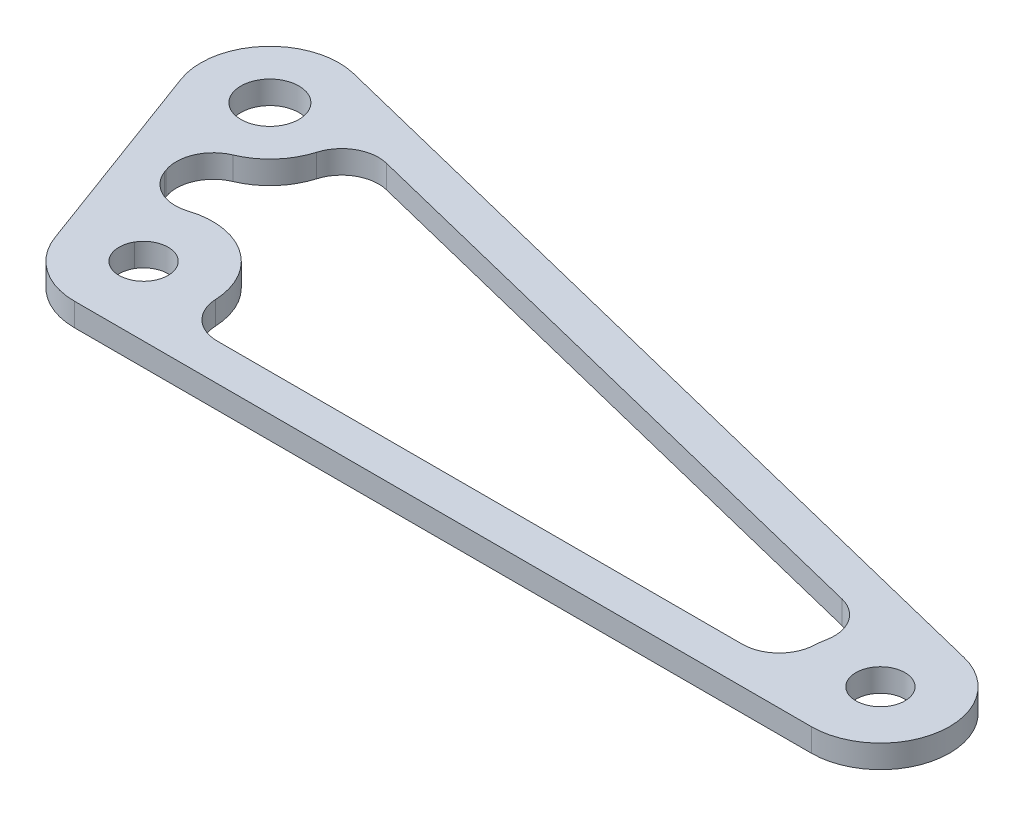
from build123d import *

# Parameters (mm, degrees)
SKETCH1_R           = 4
SKETCH1_R_2         = 3.3782
BOSS_EXTRUDE2_DEPTH = 3.175
CUT_EXTRUDE1_DEPTH  = 118.182825469
FILLET1_R           = 5.08


with BuildPart() as part:
    # Sketch1 → Boss-Extrude2 (new body)
    with BuildSketch(Plane(origin=(0, 0, 0), x_dir=(1, 0, 0), z_dir=(0, 1, 0))):
        with BuildLine():
            Line((103.850244371, 9.24666012), (-7.94064525, 36.881723073))
            ThreePointArc((-7.94064525, 36.881723073), (-17.328317762, 33.98243214), (-19.159429046, 24.329385234))
            Line((-19.159429046, 24.329385234), (-8.932978817, -3.305679122))
            ThreePointArc((-8.932978817, -3.305679122), (-5.442381435, -7.817039678), (0, -9.525))
            Line((0, -9.525), (101.56444, -9.525))
            ThreePointArc((101.56444, -9.525), (111.019598979, -1.151344291), (103.850244371, 9.24666012))
        make_face()
        with Locations((-10.226449718, 27.635062977)):
            Circle(SKETCH1_R, mode=Mode.SUBTRACT)
        with Locations((101.56444, 0)):
            Circle(SKETCH1_R_2, mode=Mode.SUBTRACT)
        Circle(SKETCH1_R_2, mode=Mode.SUBTRACT)
    extrude(amount=BOSS_EXTRUDE2_DEPTH)

    # Sketch2 → Cut-Extrude1 (cut, through all)
    with BuildSketch(Plane(origin=(0, 3.175, 0), x_dir=(1, 0, 0), z_dir=(0, 1, 0))):
        with BuildLine():
            Line((-11.471520277, 18.191788952), (-7.092376249, 6.357973273))
            ThreePointArc((-7.092376249, 6.357973273), (5.442381324, 7.817039755), (8.424226968, -4.445))
            Line((8.424226968, -4.445), (93.140213032, -4.445))
            ThreePointArc((93.140213032, -4.445), (92.109280984, 1.151343992), (94.453094389, 6.336749056))
            Line((94.453094389, 6.336749056), (-0.981687242, 29.928530168))
            ThreePointArc((-0.981687242, 29.928530168), (-3.12458086, 21.287694726), (-11.471520277, 18.191788952))
        make_face()
    extrude(amount=-CUT_EXTRUDE1_DEPTH, mode=Mode.SUBTRACT)

    # Fillet1
    fillet1_edges = [part.edges().sort_by_distance(p)[0] for p in [
        (94.453094389, 1.5875, -6.336749056),
        (93.140213032, 1.5875, 4.445),
        (8.424226968, 1.5875, 4.445),
        (-0.981687242, 1.5875, -29.928530168),
        (-11.471520277, 1.5875, -18.191788952),
        (-7.092376249, 1.5875, -6.357973273),
    ]]
    fillet(fillet1_edges, radius=FILLET1_R)


solid = part.part
